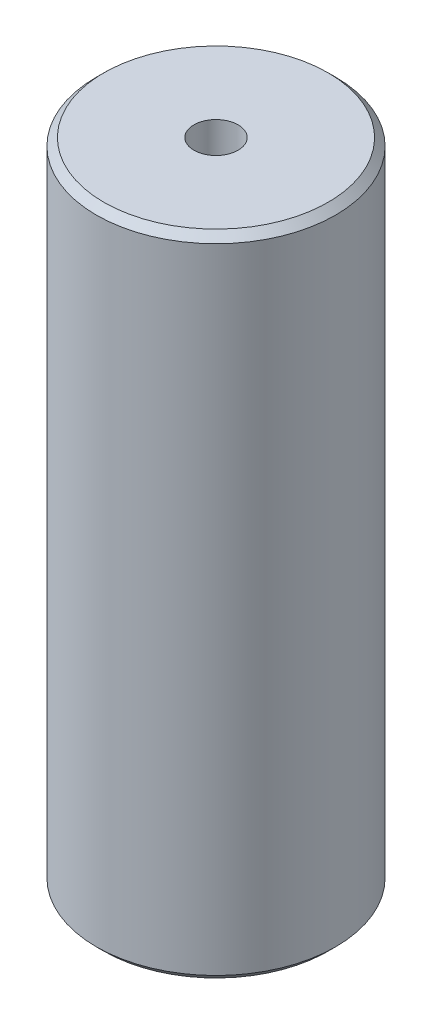
from build123d import *

# Parameters (mm, degrees)
SKETCH1_R           = 5
BOSS_EXTRUDE1_DEPTH = 27.120227162
SKETCH2_R           = 0.922948922
CUT_EXTRUDE1_DEPTH  = 29.026892823
CHAMFER1_SIZE       = 0.310430917


with BuildPart() as part:
    # Sketch1 → Boss-Extrude1 (new body)
    with BuildSketch(Plane(origin=(0, 0, 0), x_dir=(1, 0, 0), z_dir=(0, 1, 0))):
        Circle(SKETCH1_R)
    extrude(amount=BOSS_EXTRUDE1_DEPTH)

    # Sketch2 → Cut-Extrude1 (cut, through all)
    with BuildSketch(Plane(origin=(0, 0, 0), x_dir=(1, 0, 0), z_dir=(0, 1, 0))):
        Circle(SKETCH2_R)
    extrude(amount=CUT_EXTRUDE1_DEPTH, mode=Mode.SUBTRACT)

    # Chamfer1
    chamfer1_edges = [part.edges().sort_by_distance(p)[0] for p in [
        (-5, 27.120227162, 0),
        (-5, 0, 0),
    ]]
    chamfer(chamfer1_edges, length=CHAMFER1_SIZE)


solid = part.part
